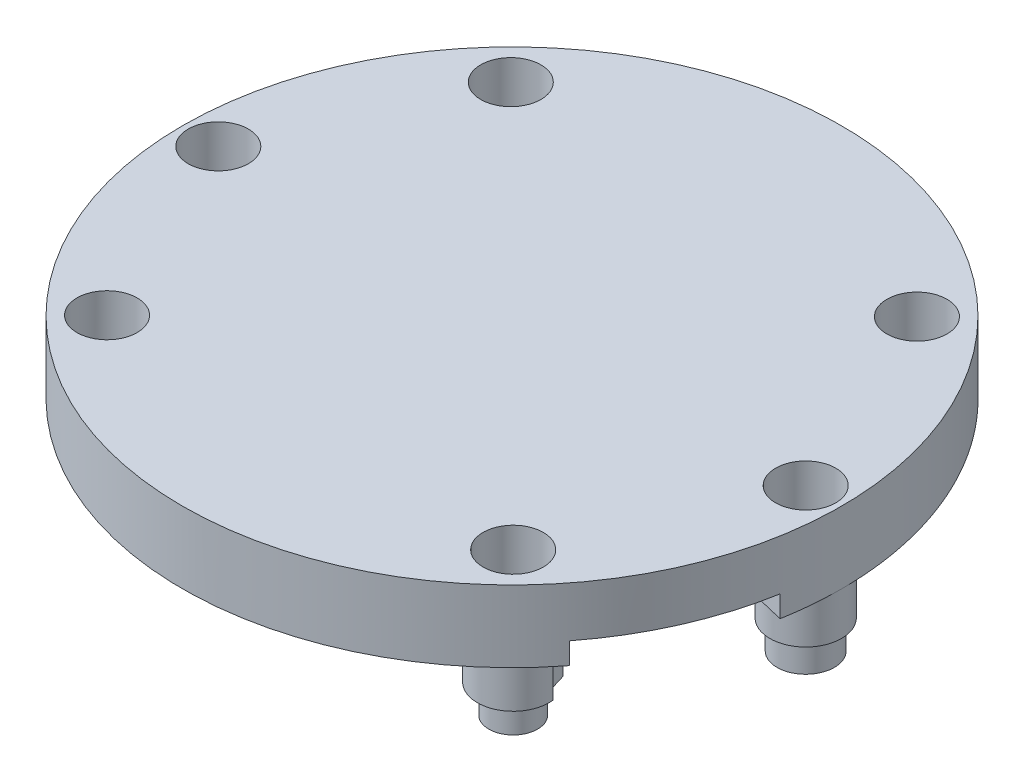
from build123d import *

# Parameters (mm, degrees)
SKETCH_1_R           = 23
SKETCH_1_R_2         = 1.05
EXTRUDE_1_DEPTH      = 5
SKETCH_2_R           = 2.5
EXTRUDE_2_DEPTH      = 5
SKETCH_3_R           = 2.1
CUT_EXTRUDE_1_DEPTH  = 4
SKETCH_4_R           = 1.125
CUT_EXTRUDE_2_DEPTH  = 15
CUT_EXTRUDE_START    = -2
SKETCH_5_R           = 2.5
SKETCH_5_R_2         = 1.6
CUT_EXTRUDE_8_DEPTH  = 2
SKETCH_6_R           = 2.5
SKETCH_6_R_2         = 1.8
CUT_EXTRUDE_9_DEPTH  = 2
SKETCH_7_R           = 2.5
SKETCH_7_R_2         = 2
CUT_EXTRUDE_10_DEPTH = 2
SKETCH_8_R           = 2.5
SKETCH_8_R_2         = 1.6
CUT_EXTRUDE_11_DEPTH = 2
SKETCH_9_R           = 2.5
SKETCH_9_R_2         = 2
CUT_EXTRUDE_12_DEPTH = 2
SKETCH_10_R          = 2.5
SKETCH_10_R_2        = 1.7
CUT_EXTRUDE_13_DEPTH = 2
CUT_EXTRUDE_16_DEPTH = 2
CUT_EXTRUDE_17_DEPTH = 3
CUT_EXTRUDE_19_DEPTH = 3
CUT_EXTRUDE_20_DEPTH = 1.5
CUT_EXTRUDE_21_DEPTH = 1.5


with BuildPart() as part:
    # 草图1 → 凸台-拉伸1 (new body)
    with BuildSketch(Plane(origin=(0, 0, 0), x_dir=(1, 0, 0), z_dir=(0, 1, 0))):
        Circle(SKETCH_1_R)
        with Locations((-20.5, 0)):
            Circle(SKETCH_1_R_2, mode=Mode.SUBTRACT)
        with Locations((20.5, 0)):
            Circle(SKETCH_1_R_2, mode=Mode.SUBTRACT)
        with Locations((-14.175, 14.09065)):
            Circle(SKETCH_1_R_2, mode=Mode.SUBTRACT)
        with Locations((14.17394, 14.09065)):
            Circle(SKETCH_1_R_2, mode=Mode.SUBTRACT)
        with Locations((14.17394, -14.09065)):
            Circle(SKETCH_1_R_2, mode=Mode.SUBTRACT)
        with Locations((-14.175, -14.09065)):
            Circle(SKETCH_1_R_2, mode=Mode.SUBTRACT)
    extrude(amount=EXTRUDE_1_DEPTH)

    # 草图2 → 凸台-拉伸2 (add)
    with BuildSketch(Plane.XZ):
        with Locations((-14.175, 14.09065)):
            Circle(SKETCH_2_R)
        with Locations((-20.5, 0)):
            Circle(SKETCH_2_R)
        with Locations((14.17394, 14.09065)):
            Circle(SKETCH_2_R)
        with Locations((20.5, 0)):
            Circle(SKETCH_2_R)
        with Locations((14.17394, -14.09065)):
            Circle(SKETCH_2_R)
        with Locations((-14.175, -14.09065)):
            Circle(SKETCH_2_R)
    extrude(amount=EXTRUDE_2_DEPTH)

    # 草图3 → 切除-拉伸1 (cut)
    with BuildSketch(Plane(origin=(0, 5, 0), x_dir=(1, 0, 0), z_dir=(0, 1, 0))):
        with Locations((-14.175, 14.09065)):
            Circle(SKETCH_3_R)
        with Locations((14.17394, 14.09065)):
            Circle(SKETCH_3_R)
        with Locations((20.5, 0)):
            Circle(SKETCH_3_R)
        with Locations((14.17394, -14.09065)):
            Circle(SKETCH_3_R)
        with Locations((-14.175, -14.09065)):
            Circle(SKETCH_3_R)
        with Locations((-20.5, 0)):
            Circle(SKETCH_3_R)
    extrude(amount=-CUT_EXTRUDE_1_DEPTH, mode=Mode.SUBTRACT)

    # 草图4 → 切除-拉伸2 (cut)
    with BuildSketch(Plane(origin=(0, 5, 0), x_dir=(1, 0, 0), z_dir=(0, 1, 0))):
        with Locations((-14.175, 14.09065)):
            Circle(SKETCH_4_R)
        with Locations((14.17394, 14.09065)):
            Circle(SKETCH_4_R)
        with Locations((20.5, 0)):
            Circle(SKETCH_4_R)
        with Locations((14.17394, -14.09065)):
            Circle(SKETCH_4_R)
        with Locations((-14.175, -14.09065)):
            Circle(SKETCH_4_R)
        with Locations((-20.5, 0)):
            Circle(SKETCH_4_R)
    extrude(amount=-CUT_EXTRUDE_2_DEPTH, mode=Mode.SUBTRACT)

    # 草图5 → 切除-拉伸8 (cut)
    with BuildSketch(Plane.XZ.offset(5).offset(CUT_EXTRUDE_START)):
        with Locations((-14.175, 14.09065)):
            Circle(SKETCH_5_R)
        with Locations((-14.175, 14.09065)):
            Circle(SKETCH_5_R_2, mode=Mode.SUBTRACT)
    extrude(amount=CUT_EXTRUDE_8_DEPTH, mode=Mode.SUBTRACT)

    # 草图6 → 切除-拉伸9 (cut)
    with BuildSketch(Plane.XZ.offset(5).offset(CUT_EXTRUDE_START)):
        with Locations((-20.5, 0)):
            Circle(SKETCH_6_R)
        with Locations((-20.5, 0)):
            Circle(SKETCH_6_R_2, mode=Mode.SUBTRACT)
    extrude(amount=CUT_EXTRUDE_9_DEPTH, mode=Mode.SUBTRACT)

    # 草图7 → 切除-拉伸10 (cut)
    with BuildSketch(Plane(origin=(0, -5, 0), x_dir=(-1, 0, 0), z_dir=(0, -1, 0)).offset(CUT_EXTRUDE_START)):
        with Locations((14.175, 14.09065)):
            Circle(SKETCH_7_R)
        with Locations((14.175, 14.09065)):
            Circle(SKETCH_7_R_2, mode=Mode.SUBTRACT)
    extrude(amount=CUT_EXTRUDE_10_DEPTH, mode=Mode.SUBTRACT)

    # 草图8 → 切除-拉伸11 (cut)
    with BuildSketch(Plane.XZ.offset(5).offset(CUT_EXTRUDE_START)):
        with Locations((14.17394, -14.09065)):
            Circle(SKETCH_8_R)
        with Locations((14.17394, -14.09065)):
            Circle(SKETCH_8_R_2, mode=Mode.SUBTRACT)
    extrude(amount=CUT_EXTRUDE_11_DEPTH, mode=Mode.SUBTRACT)

    # 草图9 → 切除-拉伸12 (cut)
    with BuildSketch(Plane.XZ.offset(5).offset(CUT_EXTRUDE_START)):
        with Locations((20.5, 0)):
            Circle(SKETCH_9_R)
        with Locations((20.5, 0)):
            Circle(SKETCH_9_R_2, mode=Mode.SUBTRACT)
    extrude(amount=CUT_EXTRUDE_12_DEPTH, mode=Mode.SUBTRACT)

    # 草图10 → 切除-拉伸13 (cut)
    with BuildSketch(Plane.XZ.offset(5).offset(CUT_EXTRUDE_START)):
        with Locations((14.17394, 14.09065)):
            Circle(SKETCH_10_R)
        with Locations((14.17394, 14.09065)):
            Circle(SKETCH_10_R_2, mode=Mode.SUBTRACT)
    extrude(amount=CUT_EXTRUDE_13_DEPTH, mode=Mode.SUBTRACT)

    # 草图11 → 切除-拉伸16 (cut)
    with BuildSketch(Plane.XZ.offset(5)):
        Polygon((12.608520232, -14.996623442), (14.592411315, -14.996623442), (14.850877498, -15.667161835), (14.107461771, -16.133985859), align=None)
    extrude(amount=-CUT_EXTRUDE_16_DEPTH, mode=Mode.SUBTRACT)

    # 草图12 → 切除-拉伸17 (cut)
    with BuildSketch(Plane.XZ.offset(3)):
        Polygon((-16.532575276, 13.258881512), (-12.356285849, 11.671220338), (-12.932897547, 10.15446262), (-17.780805718, 12.370898559), align=None)
    extrude(amount=-CUT_EXTRUDE_17_DEPTH, mode=Mode.SUBTRACT)

    # 草图14 → 切除-拉伸19 (cut)
    with BuildSketch(Plane.XZ.offset(3)):
        Polygon((16.114731295, 13.792611127), (15.450705882, 11.628380151), (16.311479566, 11.185696542), (17.516562723, 13.792611127), align=None)
    extrude(amount=-CUT_EXTRUDE_19_DEPTH, mode=Mode.SUBTRACT)

    # 草图15 → 切除-拉伸20 (cut)
    with BuildSketch(Plane.XZ):
        Polygon((-22.241407965, 5.858307925), (-16.316740095, 3.404648656), (-12.222092215, 11.371168244), (-18.178189809, 14.090898313), (-20.421166497, 14.194915818), (-22.241407965, 8.122157481), align=None)
    extrude(amount=-CUT_EXTRUDE_20_DEPTH, mode=Mode.SUBTRACT)

    # 草图16 → 切除-拉伸21 (cut)
    with BuildSketch(Plane.XZ):
        Polygon((20.766517215, 15.17706096), (16.324142004, 13.390131198), (15.842282547, 12.651862394), (15.814848421, 12.314774306), (18.997953813, 3.071930445), (24.148001801, 4.301442289), align=None)
    extrude(amount=-CUT_EXTRUDE_21_DEPTH, mode=Mode.SUBTRACT)


solid = part.part
